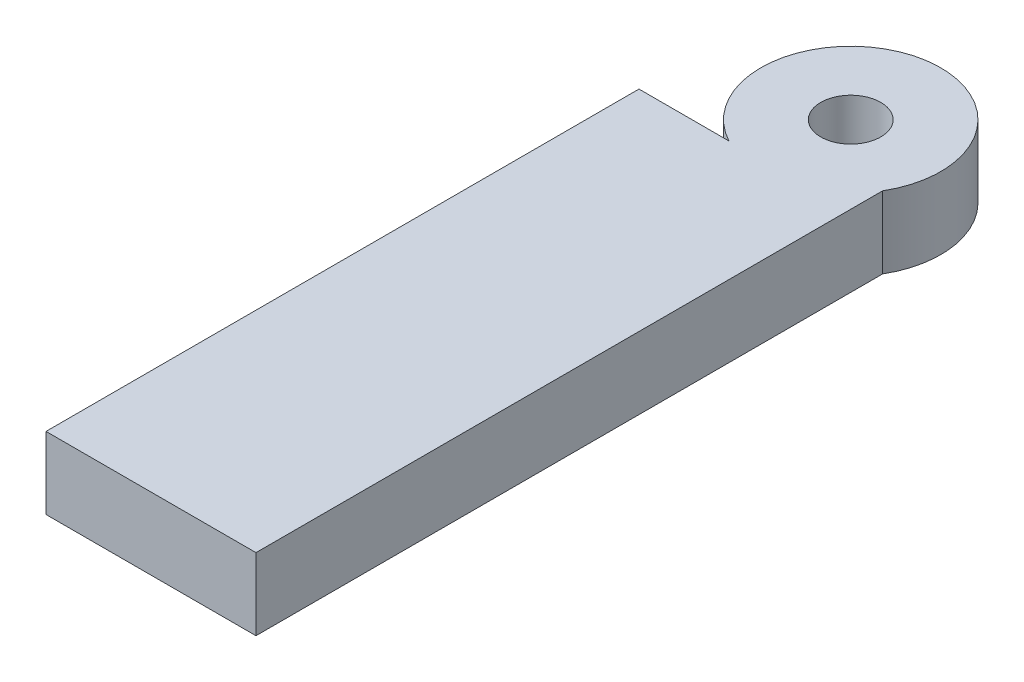
from build123d import *

# Parameters (mm, degrees)
SKETCH1_R           = 3.175
BOSS_EXTRUDE1_DEPTH = 7.62
SKETCH2_R           = 1.27
CUT_EXTRUDE1_DEPTH  = 6.35
BOSS_EXTRUDE2_START = 9.525
SKETCH3_W           = 62.764867648
SKETCH3_H           = 7.62
SKETCH3_R           = 1.27
BOSS_EXTRUDE2_DEPTH = 9.525


with BuildPart() as part:
    # Sketch1 → Boss-Extrude1 (new body)
    with BuildSketch(Plane(origin=(0, 0, 0), x_dir=(1, 0, 0), z_dir=(0, 1, 0))):
        with BuildLine():
            Line((-4.490128061, -8.400260413), (-4.490128061, -71.165128061))
            Line((-4.490128061, -71.165128061), (8.209871939, -71.165128061))
            Line((8.209871939, -71.165128061), (8.209871939, -4.829454186))
            ThreePointArc((8.209871939, -4.829454186), (-2.578136518, 9.169451297), (-4.490128061, -8.400260413))
        make_face()
        Circle(SKETCH1_R, mode=Mode.SUBTRACT)
    extrude(amount=BOSS_EXTRUDE1_DEPTH)

    # Sketch2 → Cut-Extrude1 (cut)
    with BuildSketch(Plane.ZY.offset(4.490128061)):
        with Locations((14.750260413, 3.81)):
            Circle(SKETCH2_R)
        with Locations((52.850260413, 3.81)):
            Circle(SKETCH2_R)
    extrude(amount=-CUT_EXTRUDE1_DEPTH, mode=Mode.SUBTRACT)

    # Sketch3 → Boss-Extrude2 (add)
    with BuildSketch(Plane.ZY.offset(4.490128061).offset(BOSS_EXTRUDE2_START)):
        with Locations((39.782694237, 3.81)):
            Rectangle(SKETCH3_W, SKETCH3_H)
        with Locations((52.850260413, 3.81)):
            Circle(SKETCH3_R, mode=Mode.SUBTRACT)
        with Locations((14.750260413, 3.81)):
            Circle(SKETCH3_R, mode=Mode.SUBTRACT)
    extrude(amount=-BOSS_EXTRUDE2_DEPTH)


solid = part.part
